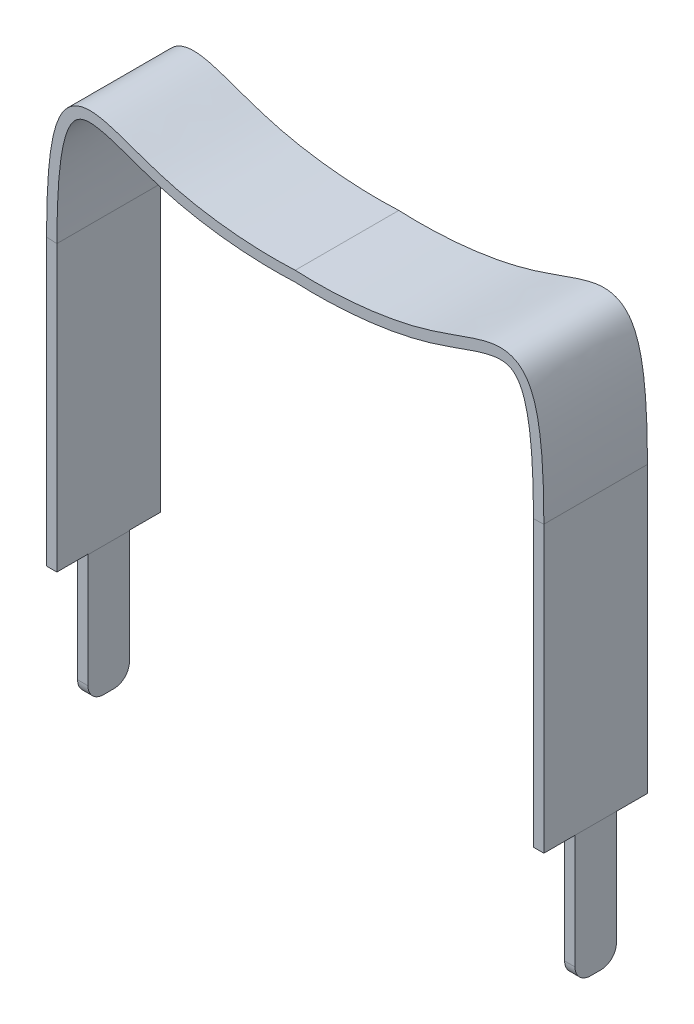
from build123d import *
from OCP.BRepAlgoAPI import BRepAlgoAPI_Cut
from OCP.TopTools import TopTools_ListOfShape

# Parameters (mm, degrees)
SWEEP1_START       = -1
SWEEP1_DEPTH       = 2
CUT_EXTRUDE1_DEPTH = 13.539095319


with BuildPart() as part:
    # Sweep1: read off the stored shape, not the designer's step
    # Sweep1 outline → Sweep1 (new body)
    with BuildSketch(Plane.XY.offset(SWEEP1_START)):
        with BuildLine():
            add(Edge.make_bspline(
                [(4.799889988, 0.00468939), (4.797369069, 1.642562327), (4.638164453, 2.334466449), (3.964943418, 2.582671094), (3.713094835, 2.522211735), (3.134768334, 2.334508393), (2.802517197, 2.199990997), (1.734148577, 1.907746322), (0.871144224, 1.809805641), (0, 1.85)],
                knots=[0, 0, 0, 0, 0.345603902, 0.345603902, 0.518405854, 0.518405854, 0.691207805, 0.691207805, 1, 1, 1, 1], degree=3))
            Line((0, 1.85), (0, 1.65))
            add(Edge.make_bspline(
                [(4.600109934, -0.004621931), (4.598155119, 1.675763362), (4.412307079, 2.197868226), (3.984680113, 2.365812038), (3.772363594, 2.330840501), (3.215856745, 2.151313393), (2.877439643, 2.014030834), (1.772090627, 1.709802724), (0.892346641, 1.609793242), (0, 1.65)],
                knots=[4.625e-06, 4.625e-06, 4.625e-06, 4.625e-06, 0.345603902, 0.345603902, 0.518405854, 0.518405854, 0.691207805, 0.691207805, 1, 1, 1, 1], degree=3))
            Line((4.600109934, -0.004621931), (4.60010377, -8.00455448))
            Line((4.60010377, -8.00455448), (4.79989623, -7.99544552))
            Line((4.79989623, -7.99544552), (4.799889988, 0.00468939))
        make_face()
    sweep1 = extrude(amount=SWEEP1_DEPTH)

    # Mirror1: Sweep1 across plane
    add(sweep1.mirror(Plane(origin=(0, 0, 0), x_dir=(0, 0, 1), z_dir=(1, 0, 0))))


with BuildPart() as cut_extrude1_tool:
    # Sketch3 → Cut-Extrude1 (new, through all)
    with BuildSketch(Plane(origin=(4.79989623, 0, 0), x_dir=(0, 0, -1), z_dir=(1, 0, 0))):
        with BuildLine():
            Line((-1, -5.49544552), (-0.4, -5.49544552))
            Line((-0.4, -5.49544552), (-0.4, -7.69544552))
            ThreePointArc((-0.4, -7.69544552), (-0.312132034, -7.907577554), (-0.1, -7.99544552))
            Line((-0.1, -7.99544552), (0.1, -7.99544552))
            ThreePointArc((0.1, -7.99544552), (0.312132034, -7.907577554), (0.4, -7.69544552))
            Line((0.4, -7.69544552), (0.4, -5.49544552))
            Line((0.4, -5.49544552), (1, -5.49544552))
            Line((1, -5.49544552), (1, -8.49544552))
            Line((1, -8.49544552), (-1, -8.49544552))
            Line((-1, -8.49544552), (-1, -5.49544552))
        make_face()
    extrude(amount=-CUT_EXTRUDE1_DEPTH)


with BuildPart() as part_1:
    add(part.part)

    # Cut-Extrude1: cut by cut_extrude1_tool, with a tolerance
    cut_extrude1_stock = TopTools_ListOfShape()
    cut_extrude1_stock.Append(part_1.part.wrapped)
    cut_extrude1_tools = TopTools_ListOfShape()
    cut_extrude1_tools.Append(cut_extrude1_tool.part.wrapped)
    cut_extrude1_cut = BRepAlgoAPI_Cut()
    cut_extrude1_cut.SetArguments(cut_extrude1_stock)
    cut_extrude1_cut.SetTools(cut_extrude1_tools)
    cut_extrude1_cut.SetFuzzyValue(0.00001)
    cut_extrude1_cut.Build()
    add(Compound.cast(cut_extrude1_cut.Shape()).solids(), mode=Mode.REPLACE)


solid = part_1.part
